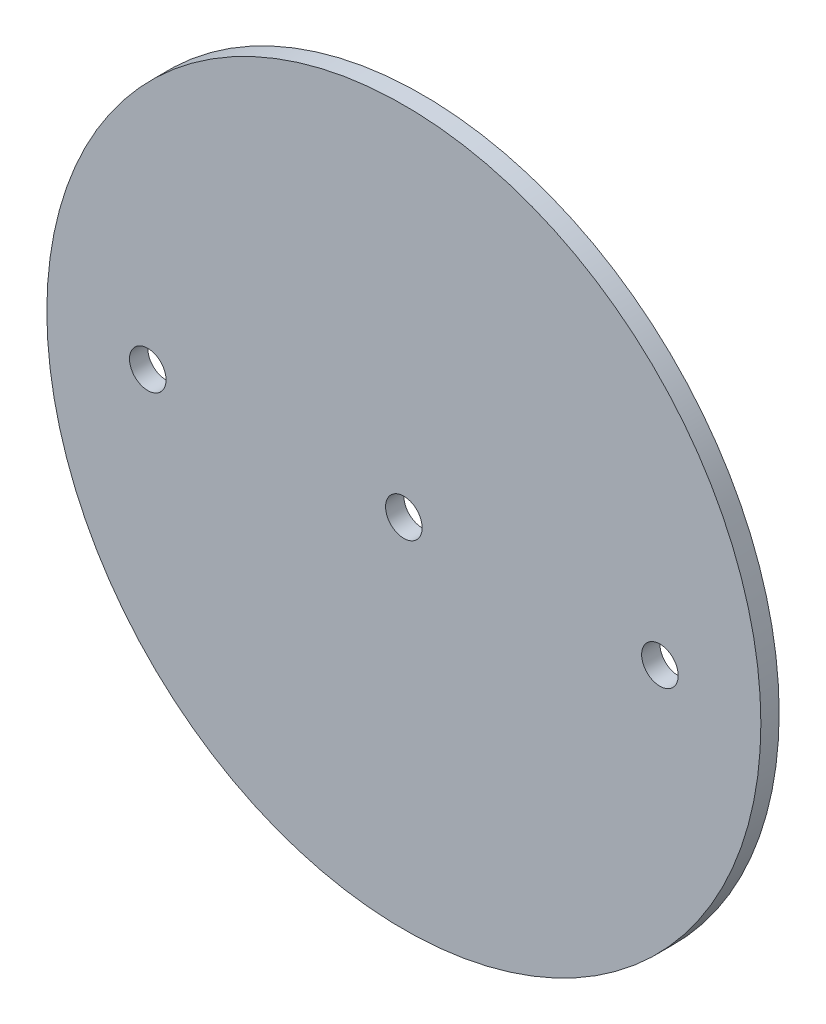
from build123d import *

# Parameters (mm, degrees)
SKETCH1_R                   = 61.976
BOSS_EXTRUDE1_DEPTH         = 1.5875
F_1_4_0_25_DIAMETER_HOLE1_D = 6.35


with BuildPart() as part:
    # Sketch1 → Boss-Extrude1 (new, symmetric)
    with BuildSketch(Plane.XY):
        Circle(SKETCH1_R)
    extrude(amount=BOSS_EXTRUDE1_DEPTH, both=True)

    # 1/4 (0.25) Diameter Hole1 (through all)
    with Locations(Plane.XY.offset(1.5875)):
        with Locations((-44.45, 0), (0, 0), (44.45, 0)):
            Hole(F_1_4_0_25_DIAMETER_HOLE1_D / 2)


solid = part.part
